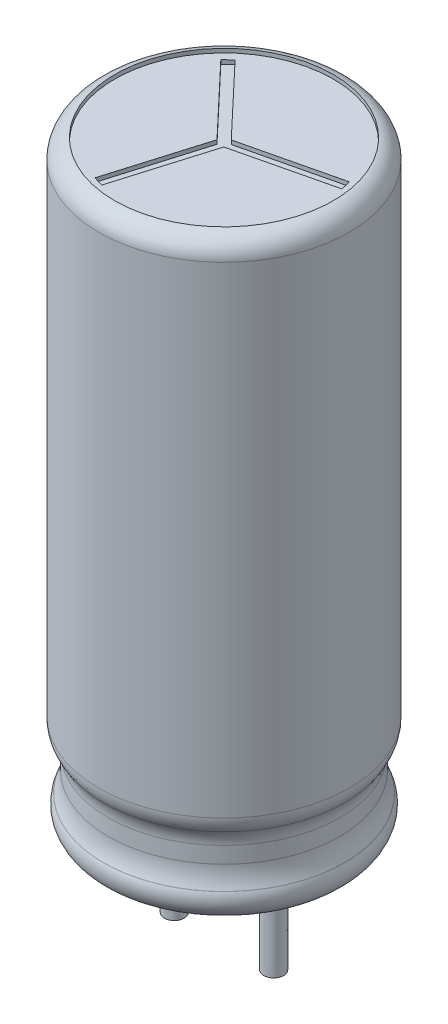
from build123d import *

# Parameters (mm, degrees)
SKETCH2_R          = 2.75
CUT_EXTRUDE1_DEPTH = 0.1
CUT_EXTRUDE2_DEPTH = 0.1
FILLET1_R          = 0.5
SKETCH4_W          = 0.25
SKETCH4_H          = 2.5


with BuildPart() as part:
    # Sketch1 → Revolve1 (revolve)
    with BuildSketch(Plane.XY, mode=Mode.PRIVATE) as revolve1_sk:
        with BuildLine():
            Line((3.15, 15), (0, 15))
            Line((0, 15), (0, 0))
            Line((0, 0), (3.030208333, 0))
            ThreePointArc((3.030208333, 0), (3.115870139, 0.362697063), (3.030208333, 0.725394126))
            ThreePointArc((3.030208333, 0.725394126), (2.940770958, 0.972019442), (2.910416667, 1.232599004))
            Line((2.910416667, 1.232599004), (2.910416667, 1.642400996))
            ThreePointArc((2.910416667, 1.642400996), (2.941064683, 1.842850794), (3.030208333, 2.024984899))
            ThreePointArc((3.030208333, 2.024984899), (3.119351983, 2.207119004), (3.15, 2.407568802))
            Line((3.15, 2.407568802), (3.15, 15))
        make_face()
    revolve(revolve1_sk.sketch.rotate(Axis((0, 15, 0), (0, -1, 0)), 270), axis=Axis((0, 15, 0), (0, -1, 0)))

    # Sketch2 → Cut-Extrude1 (cut)
    with BuildSketch(Plane(origin=(0, 15, 0), x_dir=(-1, 0, 0), z_dir=(0, 1, 0))):
        with Locations(Location((0, 0, 0), (0, 0, 270))):
            Circle(SKETCH2_R)
    extrude(amount=-CUT_EXTRUDE1_DEPTH, mode=Mode.SUBTRACT)

    # Sketch3 → Cut-Extrude2 (cut)
    with BuildSketch(Plane(origin=(0, 14.9, 0), x_dir=(-1, 0, 0), z_dir=(0, 1, 0))):
        Polygon((1.653472744, -1.932293167), (1.837973446, -1.757720858), (0.142645036, 0.03402539), (0.846678598, 2.398095985), (0.603244193, 2.470592124), (-0.10078937, 0.10652153), (-2.500151342, -0.465802817), (-2.441217638, -0.712871266), (-0.041855666, -0.14054692), align=None)
    extrude(amount=-CUT_EXTRUDE2_DEPTH, mode=Mode.SUBTRACT)

    # Fillet1
    # the kernel refuses this fillet: 0.5 mm, written as the material it takes off along each edge
    with BuildSketch(Plane(origin=(0, 15, 0), x_dir=(0, 0, -1), z_dir=(-1, 0, 0))) as fillet1_piece_1:
        with BuildLine():
            CenterArc((2.65, 0.489897949), FILLET1_R, 281.536959033, 78.463040967)
            Line((3.15, 0.489897949), (3.16, 0.489897949))
            Line((3.16, 0.489897949), (3.16, 0))
            Line((3.16, 0), (3.15, -0.01))
            ThreePointArc((3.15, -0.01), (2.95, -0.01), (2.752, -0.009797959))
            Line((2.752, -0.009797959), (2.75, 0))
        make_face()
    revolve(axis=Axis((0, 15, 0), (0, -1, 0)), mode=Mode.SUBTRACT)
    with BuildSketch(Plane(origin=(0, 0, 0), x_dir=(0, 0, -1), z_dir=(-1, 0, 0))) as fillet1_piece_2:
        with BuildLine():
            CenterArc((2.583882439, -0.5), FILLET1_R, 333.771257748, 116.228742252)
            Line((2.583882439, 0), (2.583882439, 0.01))
            Line((2.583882439, 0.01), (3.030208333, 0.01))
            Line((3.030208333, 0.01), (3.039151656, 0.004474035))
            ThreePointArc((3.039151656, 0.004474035), (3.125866344, -0.360201414), (3.041371195, -0.725397511))
            Line((3.041371195, -0.725397511), (3.032400827, -0.720977952))
        make_face()
    revolve(axis=Axis((0, 0, 0), (0, -1, 0)), mode=Mode.SUBTRACT)

    # Sketch4 → Revolve2 (revolve)
    with BuildSketch(Plane(origin=(0, 0, 0), x_dir=(-1, 0, 0), z_dir=(0, 0, -1)), mode=Mode.PRIVATE) as revolve2_sk:
        with Locations((-1.375, -1.25)):
            Rectangle(SKETCH4_W, SKETCH4_H)
    revolve2 = revolve(revolve2_sk.sketch.rotate(Axis((1.25, -2.5, 0), (0, 1, 0)), 180), axis=Axis((1.25, -2.5, 0), (0, 1, 0)))

    # Simetría2: Revolve2 across plane
    add(revolve2.mirror(Plane(origin=(0, 0, 0), x_dir=(0, 0, 1), z_dir=(1, 0, 0))))


solid = part.part
